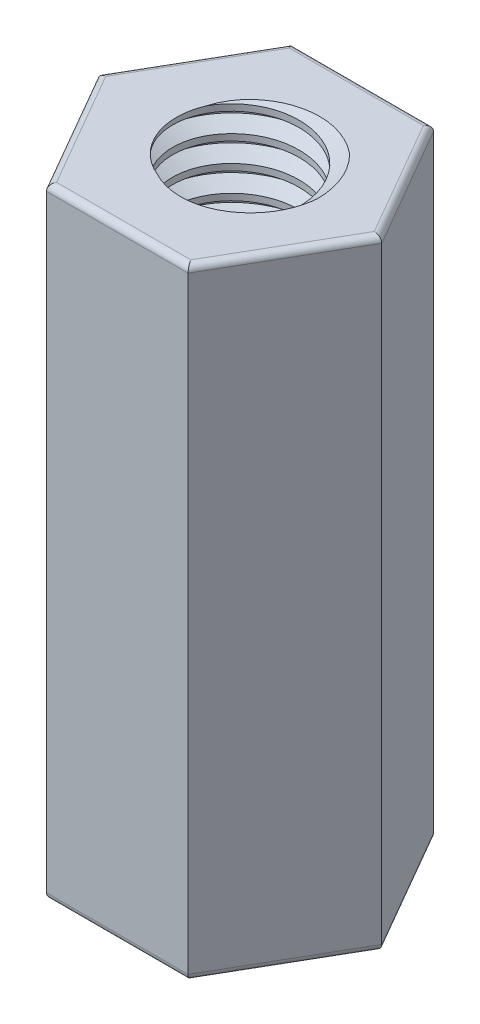
from build123d import *

# Parameters (mm, degrees)
SKETCH1_R           = 1.5
BOSS_EXTRUDE1_DEPTH = 12
THREAD1_PITCH       = 0.5
CUT_EXTRUDE1_DEPTH  = 13.956136968
CUT_EXTRUDE2_START  = 12
CUT_EXTRUDE2_DEPTH  = 1.956136968
FILLET1_R           = 0.125


with BuildPart() as part:
    # Sketch1 → Boss-Extrude1 (new body)
    with BuildSketch(Plane(origin=(0, 0, 0), x_dir=(1, 0, 0), z_dir=(0, 1, 0))):
        Polygon((2.742413779, 0), (1.371206889, 2.375), (-1.371206889, 2.375), (-2.742413779, 0), (-1.371206889, -2.375), (1.371206889, -2.375), align=None)
        with Locations(Location((0, 0, 0), (0, 0, 270))):
            Circle(SKETCH1_R, mode=Mode.SUBTRACT)
    extrude(amount=BOSS_EXTRUDE1_DEPTH)

    # Thread1: the profile of Thread Profile1 profile screwed along a right-hand helix of 29 turns, 6 arcs to a turn; built about Z, then put on its axis
    thread1_z = Axis((0, 0, 0), (0, 0, 1))
    thread1_corners = [(1.5006, 0, -0.00034641), (1.5006, 0, 0.437846409), (1.229367063, 0, 0.281249999), (1.229367063, 0, 0.156249999)]
    with BuildLine(mode=Mode.PRIVATE) as thread1_profile:
        Line(thread1_corners[0], thread1_corners[1])
        Line(thread1_corners[1], thread1_corners[2])
        Line(thread1_corners[2], thread1_corners[3])
        Line(thread1_corners[3], thread1_corners[0])
    thread1_cap = Face(thread1_profile.wire())
    thread1_turn_angles = [0, 30, 60, 90, 120, 150, 180, 210, 240, 270, 300, 330, 360]
    thread1_turn_weights = [1, 0.8660254037844387, 1, 0.8660254037844387, 1, 0.8660254037844387, 1, 0.8660254037844387, 1, 0.8660254037844387, 1, 0.8660254037844387, 1]
    thread1_turn_rails = [Edge.make_bspline([Vector(p[0], p[1], 0).rotate(thread1_z, thread1_turn_angles[k]) / thread1_turn_weights[k] + Vector(0, 0, p[2] + THREAD1_PITCH * thread1_turn_angles[k] / 360) for k in range(13)], [0, 0, 0, 1, 1, 2, 2, 3, 3, 4, 4, 5, 5, 6, 6, 6], 2, thread1_turn_weights) for p in thread1_corners]
    thread1_turn_sides = [Face.make_surface_from_curves(thread1_turn_rails[p[0]], thread1_turn_rails[p[1]]) for p in [(0, 1), (1, 2), (2, 3), (3, 0)]]
    thread1 = Plane(origin=(0, -2.5, 0), x_dir=(1, 0, 0), z_dir=(0, 1, 0)) * Solid(Shell([*[p.moved(Location((0, 0, THREAD1_PITCH * i))) for i in range(29) for p in thread1_turn_sides], thread1_cap, thread1_cap.rotate(thread1_z, 10440).moved(Location((0, 0, THREAD1_PITCH * 10440 / 360)))]))
    add(thread1)

    # Sketch1<2> → Cut-Extrude1 (cut, through all)
    with BuildSketch(Plane(origin=(0, 0, 0), x_dir=(1, 0, 0), z_dir=(0, 1, 0))):
        Polygon((2.742413779, 0), (1.371206889, 2.375), (-1.371206889, 2.375), (-2.742413779, 0), (-1.371206889, -2.375), (1.371206889, -2.375), align=None)
    extrude(amount=-CUT_EXTRUDE1_DEPTH, mode=Mode.SUBTRACT)

    # Sketch1<3> → Cut-Extrude2 (cut, through all)
    with BuildSketch(Plane(origin=(0, 0, 0), x_dir=(1, 0, 0), z_dir=(0, 1, 0)).offset(CUT_EXTRUDE2_START)):
        Polygon((2.742413779, 0), (1.371206889, 2.375), (-1.371206889, 2.375), (-2.742413779, 0), (-1.371206889, -2.375), (1.371206889, -2.375), align=None)
    extrude(amount=CUT_EXTRUDE2_DEPTH, mode=Mode.SUBTRACT)

    # Fillet1
    fillet1_edges = [part.edges().sort_by_distance(p)[0] for p in [
        (0, 12, -2.375),
        (-2.056810334, 12, -1.1875),
        (-2.056810334, 12, 1.1875),
        (0, 12, 2.375),
        (2.056810334, 12, 1.1875),
        (0, 0, 2.375),
        (-2.056810334, 0, 1.1875),
        (-2.056810334, 0, -1.1875),
        (0, 0, -2.375),
        (2.056810334, 0, -1.1875),
        (2.056810334, 0, 1.1875),
        (2.056810334, 12, -1.1875),
    ]]
    fillet(fillet1_edges, radius=FILLET1_R)


solid = part.part
